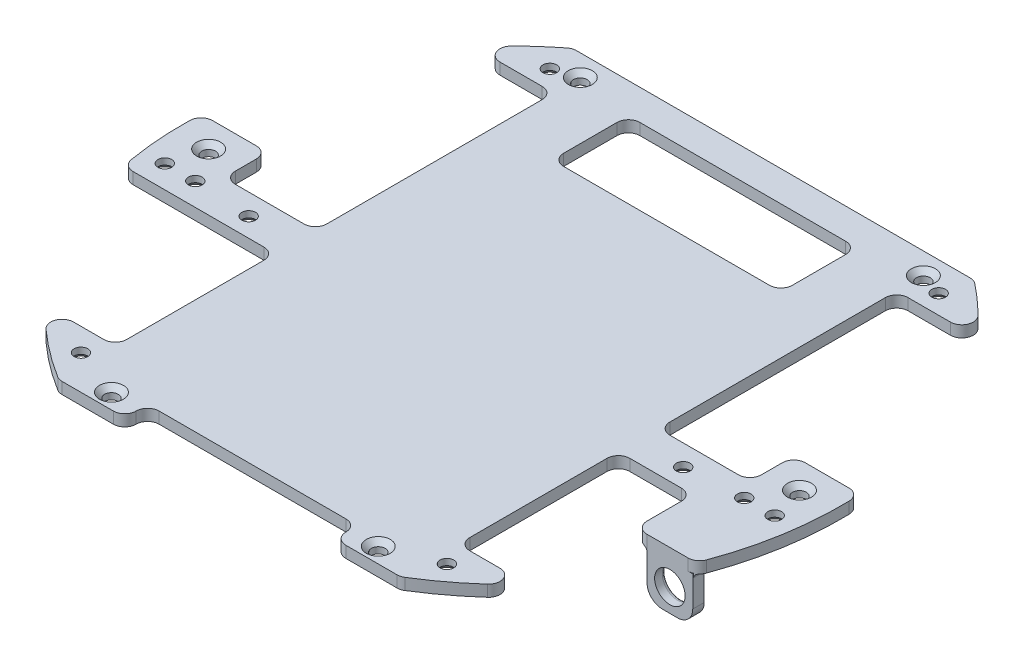
from build123d import *

# Parameters (mm, degrees)
BOSS_EXTRUDE1_DEPTH                           = 3
CSK_FOR_M3_COUNTERSUNK_FLAT_HEAD_SCR_2_COUNT  = 2
CSK_FOR_M3_COUNTERSUNK_FLAT_HEAD_SCR_2_PITCH  = 90
CSK_FOR_M3_COUNTERSUNK_FLAT_HEAD_SCR_3_COUNT  = 2
CSK_FOR_M3_COUNTERSUNK_FLAT_HEAD_SCR_3_PITCH  = 138.676782484
CSK_FOR_M3_COUNTERSUNK_FLAT_HEAD_SCR_4_COUNT  = 2
CSK_FOR_M3_COUNTERSUNK_FLAT_HEAD_SCR_4_PITCH  = 72.672209269
CSK_FOR_M3_COUNTERSUNK_FLAT_HEAD_SCR_5_COUNT  = 2
CSK_FOR_M3_COUNTERSUNK_FLAT_HEAD_SCR_5_PITCH  = 133.375410027
CSK_FOR_M3_COUNTERSUNK_FLAT_HEAD_SCR_6_COUNT  = 2
CSK_FOR_M3_COUNTERSUNK_FLAT_HEAD_SCR_6_PITCH  = 155.206314305
CSK_FOR_M3_COUNTERSUNK_FLAT_HEAD_SCR_7_COUNT  = 2
CSK_FOR_M3_COUNTERSUNK_FLAT_HEAD_SCR_7_PITCH  = 102
CSK_FOR_M3_COUNTERSUNK_FLAT_HEAD_SCR_8_COUNT  = 2
CSK_FOR_M3_COUNTERSUNK_FLAT_HEAD_SCR_8_PITCH  = 126.035709226
CSK_FOR_M3_COUNTERSUNK_FLAT_HEAD_SCR_9_COUNT  = 2
CSK_FOR_M3_COUNTERSUNK_FLAT_HEAD_SCR_9_PITCH  = 160.240444333
CSK_FOR_M3_COUNTERSUNK_FLAT_HEAD_SCR_10_COUNT = 2
CSK_FOR_M3_COUNTERSUNK_FLAT_HEAD_SCR_10_PITCH = 77.620873481
CSK_FOR_M3_COUNTERSUNK_FLAT_HEAD_SCR_11_COUNT = 2
CSK_FOR_M3_COUNTERSUNK_FLAT_HEAD_SCR_11_PITCH = 149.48244044
CSK_FOR_M3_COUNTERSUNK_FLAT_HEAD_SCR_12_COUNT = 2
CSK_FOR_M3_COUNTERSUNK_FLAT_HEAD_SCR_12_PITCH = 73.246160309
CSK_FOR_M3_COUNTERSUNK_FLAT_HEAD_SCR_13_COUNT = 2
CSK_FOR_M3_COUNTERSUNK_FLAT_HEAD_SCR_13_PITCH = 130.357201566
CSK_FOR_M3_COUNTERSUNK_FLAT_HEAD_SCR_14_COUNT = 2
CSK_FOR_M3_COUNTERSUNK_FLAT_HEAD_SCR_14_PITCH = 142.523682243
CSK_FOR_M3_COUNTERSUNK_FLAT_HEAD_SCR_15_COUNT = 2
CSK_FOR_M3_COUNTERSUNK_FLAT_HEAD_SCR_15_PITCH = 75
SKETCH14_W                                    = 60
SKETCH14_H                                    = 20
CUT_EXTRUDE1_DEPTH                            = 123.366253518
FILLET1_R                                     = 3
BOSS_EXTRUDE3_REACH                           = 115.874
SKETCH21_W                                    = 12
SKETCH21_H                                    = 12
SKETCH21_R                                    = 4
SKETCH21_2_W                                  = 12
SKETCH21_2_H                                  = 12
CUT_EXTRUDE3_DEPTH                            = 29
FILLET2_R                                     = 4
FILLET3_R                                     = 1


with BuildPart() as part:
    # Sketch1 → Boss-Extrude1 (new body)
    with BuildSketch(Plane(origin=(0, 0, 0), x_dir=(1, 0, 0), z_dir=(0, 1, 0))):
        with BuildLine():
            Line((-52.657863609, 68.625063935), (52.657863609, 68.625063935))
            ThreePointArc((52.657863609, 68.625063935), (0, -86.5), (-52.657863609, 68.625063935))
        make_face()
    extrude(amount=BOSS_EXTRUDE1_DEPTH)

    # Sketch9 → CSK for M3 Countersunk Flat Head Screw3 (revolve, cut)
    with BuildSketch(Plane(origin=(-45, 3, -63), x_dir=(0, 0, 1), z_dir=(1, 0, 0))):
        Polygon((0, 0), (0, 3), (1.8, 3), (1.8, 1.35), (3.15, 0), align=None)
    csk_for_m3_countersunk_flat_head_screw3 = revolve(axis=Axis((-45, 9.35, -63), (0, -1, 0)), mode=Mode.SUBTRACT)

    # CSK for M3 Countersunk Flat Head Scr 2: CSK for M3 Countersunk Flat Head Screw3 ×2
    with Locations(*[(i * CSK_FOR_M3_COUNTERSUNK_FLAT_HEAD_SCR_2_PITCH, 0, 0) for i in range(1, CSK_FOR_M3_COUNTERSUNK_FLAT_HEAD_SCR_2_COUNT)]):
        add(csk_for_m3_countersunk_flat_head_screw3, mode=Mode.SUBTRACT)

    # CSK for M3 Countersunk Flat Head Scr 3: CSK for M3 Countersunk Flat Head Screw3 ×2
    with Locations(*[Vector(0.8833490206949295, 0, 0.46871580689935033) * (i * CSK_FOR_M3_COUNTERSUNK_FLAT_HEAD_SCR_3_PITCH) for i in range(1, CSK_FOR_M3_COUNTERSUNK_FLAT_HEAD_SCR_3_COUNT)]):
        add(csk_for_m3_countersunk_flat_head_screw3, mode=Mode.SUBTRACT)

    # CSK for M3 Countersunk Flat Head Scr 4: CSK for M3 Countersunk Flat Head Screw3 ×2
    with Locations(*[Vector(-0.4472135954999581, 0, 0.894427190999916) * (i * CSK_FOR_M3_COUNTERSUNK_FLAT_HEAD_SCR_4_PITCH) for i in range(1, CSK_FOR_M3_COUNTERSUNK_FLAT_HEAD_SCR_4_COUNT)]):
        add(csk_for_m3_countersunk_flat_head_screw3, mode=Mode.SUBTRACT)

    # CSK for M3 Countersunk Flat Head Scr 5: CSK for M3 Countersunk Flat Head Screw3 ×2
    with Locations(*[Vector(0.07497633932626105, 0, 0.9971853130392733) * (i * CSK_FOR_M3_COUNTERSUNK_FLAT_HEAD_SCR_5_PITCH) for i in range(1, CSK_FOR_M3_COUNTERSUNK_FLAT_HEAD_SCR_5_COUNT)]):
        add(csk_for_m3_countersunk_flat_head_screw3, mode=Mode.SUBTRACT)

    # CSK for M3 Countersunk Flat Head Scr 6: CSK for M3 Countersunk Flat Head Screw3 ×2
    with Locations(*[Vector(0.5154429467542566, 0, 0.8569238989789517) * (i * CSK_FOR_M3_COUNTERSUNK_FLAT_HEAD_SCR_6_PITCH) for i in range(1, CSK_FOR_M3_COUNTERSUNK_FLAT_HEAD_SCR_6_COUNT)]):
        add(csk_for_m3_countersunk_flat_head_screw3, mode=Mode.SUBTRACT)

    # Sketch13 → CSK for M3 Countersunk Flat Head Screw4 (revolve, cut)
    with BuildSketch(Plane(origin=(-51, 0, -61), x_dir=(0, 0, -1), z_dir=(1, 0, 0))):
        Polygon((0, 0), (0, 3), (1.8, 3), (1.8, 1.35), (3.15, 0), align=None)
    csk_for_m3_countersunk_flat_head_screw4 = revolve(axis=Axis((-51, -6.35, -61), (0, 1, 0)), mode=Mode.SUBTRACT)

    # CSK for M3 Countersunk Flat Head Scr 7: CSK for M3 Countersunk Flat Head Screw4 ×2
    with Locations(*[(i * CSK_FOR_M3_COUNTERSUNK_FLAT_HEAD_SCR_7_PITCH, 0, 0) for i in range(1, CSK_FOR_M3_COUNTERSUNK_FLAT_HEAD_SCR_7_COUNT)]):
        add(csk_for_m3_countersunk_flat_head_screw4, mode=Mode.SUBTRACT)

    # CSK for M3 Countersunk Flat Head Scr 8: CSK for M3 Countersunk Flat Head Screw4 ×2
    with Locations(*[Vector(0.023802777946288843, 0, 0.9997166737441362) * (i * CSK_FOR_M3_COUNTERSUNK_FLAT_HEAD_SCR_8_PITCH) for i in range(1, CSK_FOR_M3_COUNTERSUNK_FLAT_HEAD_SCR_8_COUNT)]):
        add(csk_for_m3_countersunk_flat_head_screw4, mode=Mode.SUBTRACT)

    # CSK for M3 Countersunk Flat Head Scr 9: CSK for M3 Countersunk Flat Head Screw4 ×2
    with Locations(*[Vector(0.6178215519319036, 0, 0.7863183388224227) * (i * CSK_FOR_M3_COUNTERSUNK_FLAT_HEAD_SCR_9_PITCH) for i in range(1, CSK_FOR_M3_COUNTERSUNK_FLAT_HEAD_SCR_9_COUNT)]):
        add(csk_for_m3_countersunk_flat_head_screw4, mode=Mode.SUBTRACT)

    # CSK for M3 Countersunk Flat Head Scr 10: CSK for M3 Countersunk Flat Head Screw4 ×2
    with Locations(*[Vector(-0.373610843312482, 0, 0.9275855420171965) * (i * CSK_FOR_M3_COUNTERSUNK_FLAT_HEAD_SCR_10_PITCH) for i in range(1, CSK_FOR_M3_COUNTERSUNK_FLAT_HEAD_SCR_10_COUNT)]):
        add(csk_for_m3_countersunk_flat_head_screw4, mode=Mode.SUBTRACT)

    # CSK for M3 Countersunk Flat Head Scr 11: CSK for M3 Countersunk Flat Head Screw4 ×2
    with Locations(*[Vector(0.8763571133445796, 0, 0.4816619248916773) * (i * CSK_FOR_M3_COUNTERSUNK_FLAT_HEAD_SCR_11_PITCH) for i in range(1, CSK_FOR_M3_COUNTERSUNK_FLAT_HEAD_SCR_11_COUNT)]):
        add(csk_for_m3_countersunk_flat_head_screw4, mode=Mode.SUBTRACT)

    # CSK for M3 Countersunk Flat Head Scr 12: CSK for M3 Countersunk Flat Head Screw4 ×2
    with Locations(*[Vector(-0.08191555672945391, 0, 0.996639273541688) * (i * CSK_FOR_M3_COUNTERSUNK_FLAT_HEAD_SCR_12_PITCH) for i in range(1, CSK_FOR_M3_COUNTERSUNK_FLAT_HEAD_SCR_12_COUNT)]):
        add(csk_for_m3_countersunk_flat_head_screw4, mode=Mode.SUBTRACT)

    # CSK for M3 Countersunk Flat Head Scr 13: CSK for M3 Countersunk Flat Head Screw4 ×2
    with Locations(*[Vector(0.8284927775601016, 0, 0.559999747795254) * (i * CSK_FOR_M3_COUNTERSUNK_FLAT_HEAD_SCR_13_PITCH) for i in range(1, CSK_FOR_M3_COUNTERSUNK_FLAT_HEAD_SCR_13_COUNT)]):
        add(csk_for_m3_countersunk_flat_head_screw4, mode=Mode.SUBTRACT)

    # CSK for M3 Countersunk Flat Head Scr 14: CSK for M3 Countersunk Flat Head Screw4 ×2
    with Locations(*[Vector(0.8630144693469346, 0, 0.5051792015689374) * (i * CSK_FOR_M3_COUNTERSUNK_FLAT_HEAD_SCR_14_PITCH) for i in range(1, CSK_FOR_M3_COUNTERSUNK_FLAT_HEAD_SCR_14_COUNT)]):
        add(csk_for_m3_countersunk_flat_head_screw4, mode=Mode.SUBTRACT)

    # CSK for M3 Countersunk Flat Head Scr 15: CSK for M3 Countersunk Flat Head Screw4 ×2
    with Locations(*[Vector(-0.2800000000000003, 0, 0.96) * (i * CSK_FOR_M3_COUNTERSUNK_FLAT_HEAD_SCR_15_PITCH) for i in range(1, CSK_FOR_M3_COUNTERSUNK_FLAT_HEAD_SCR_15_COUNT)]):
        add(csk_for_m3_countersunk_flat_head_screw4, mode=Mode.SUBTRACT)

    # Sketch14 → Cut-Extrude1 (cut, through all)
    with BuildSketch(Plane(origin=(0, 3, 0), x_dir=(1, 0, 0), z_dir=(0, 1, 0))):
        with BuildLine():
            Line((65.926094985, 56), (45, 56))
            Line((45, 56), (45, 5))
            Line((45, 5), (45, -6.5))
            Line((45, -6.5), (69, -6.5))
            Line((69, -6.5), (69, 5))
            Line((69, 5), (86.355370418, 5))
            ThreePointArc((86.355370418, 5), (80.297329821, 32.165024851), (65.926094985, 56))
        make_face()
        with BuildLine():
            Line((64.5, -17), (45, -17))
            Line((45, -17), (45, -59))
            Line((45, -59), (63.255434549, -59))
            ThreePointArc((63.255434549, -59), (73.067302991, -46.297075864), (80.363237864, -32))
            Line((80.363237864, -32), (64.5, -32))
            Line((64.5, -32), (64.5, -17))
        make_face()
        with BuildLine():
            Line((-45, -59), (-63.255434549, -59))
            ThreePointArc((-63.255434549, -59), (-73.067302991, -46.297075864), (-80.363237864, -32))
            ThreePointArc((-80.363237864, -32), (-82.927979827, -24.600816282), (-84.813029659, -17))
            Line((-84.813029659, -17), (-64.5, -17))
            Line((-64.5, -17), (-45, -17))
            Line((-45, -17), (-45, -59))
        make_face()
        with BuildLine():
            Line((-69, 5), (-86.355370418, 5))
            ThreePointArc((-86.355370418, 5), (-80.297329821, 32.165024851), (-65.926094985, 56))
            Line((-65.926094985, 56), (-45, 56))
            Line((-45, 56), (-45, 5))
            Line((-45, 5), (-45, -6.5))
            Line((-45, -6.5), (-69, -6.5))
            Line((-69, -6.5), (-69, 5))
        make_face()
        with Locations((0, 50.625063935)):
            Rectangle(SKETCH14_W, SKETCH14_H)
        with BuildLine():
            Line((44.791182168, -74), (27.5, -74))
            Line((27.5, -74), (27.5, -68))
            Line((27.5, -68), (-27.5, -68))
            Line((-27.5, -68), (-27.5, -74))
            Line((-27.5, -74), (-44.791182168, -74))
            ThreePointArc((-44.791182168, -74), (0, -86.5), (44.791182168, -74))
        make_face()
    extrude(amount=-CUT_EXTRUDE1_DEPTH, mode=Mode.SUBTRACT)

    # Fillet1
    fillet1_edges = [part.edges().sort_by_distance(p)[0] for p in [
        (65.926094985, 1.5, -56),
        (45, 1.5, -56),
        (86.355370418, 1.5, -5),
        (45, 1.5, 17),
        (45, 1.5, 59),
        (63.255434549, 1.5, 59),
        (-63.255434549, 1.5, 59),
        (-45, 1.5, 59),
        (-84.813029659, 1.5, 17),
        (-45, 1.5, 17),
        (-86.355370418, 1.5, -5),
        (-65.926094985, 1.5, -56),
        (-45, 1.5, -56),
        (-30, 1.5, -40.625063935),
        (-30, 1.5, -60.625063935),
        (30, 1.5, -40.625063935),
        (30, 1.5, -60.625063935),
        (80.363237864, 1.5, 32),
        (64.5, 1.5, 32),
        (64.5, 1.5, 17),
        (-52.657863609, 1.5, -68.625063935),
        (52.657863609, 1.5, -68.625063935),
        (44.791182168, 1.5, 74),
        (-27.5, 1.5, 74),
        (-27.5, 1.5, 68),
        (27.5, 1.5, 68),
        (27.5, 1.5, 74),
        (-44.791182168, 1.5, 74),
        (-69, 1.5, 6.5),
        (-69, 1.5, -5),
        (-45, 1.5, 6.5),
        (69, 1.5, -5),
        (69, 1.5, 6.5),
        (45, 1.5, 6.5),
    ]]
    fillet(fillet1_edges, radius=FILLET1_R - 0.0001)  # a hair under: the kernel refuses the full size

    # Boss-Extrude3: up to this face of the body (flat: up to its plane)
    boss_extrude3_end = Plane(part.part.faces().sort_by_distance((72.901134209, 1.5, 32))[0])
    # Sketch21 → Boss-Extrude3 (add, up to the picked face)
    with BuildSketch(Plane.XY, mode=Mode.PRIVATE) as boss_extrude3_sk1:
        with Locations((73.5, -6)):
            Rectangle(SKETCH21_W, SKETCH21_H)
        with Locations(Location((73.5, -6, 0), (0, 0, 180))):
            Circle(SKETCH21_R, mode=Mode.SUBTRACT)
    boss_extrude3_tool1 = split(extrude(boss_extrude3_sk1.sketch, amount=BOSS_EXTRUDE3_REACH, mode=Mode.PRIVATE), bisect_by=boss_extrude3_end, keep=Keep.BOTH, mode=Mode.PRIVATE)
    add(boss_extrude3_tool1.solids().sort_by(Axis((73.5, -0.169706, 0), (0, 0, 1)))[0])

    # Sketch21<2> → Cut-Extrude3 (cut)
    with BuildSketch(Plane.XY):
        with Locations((73.5, -6)):
            Rectangle(SKETCH21_2_W, SKETCH21_2_H)
    extrude(amount=CUT_EXTRUDE3_DEPTH, mode=Mode.SUBTRACT)

    # Fillet2
    fillet2_edges = [part.edges().sort_by_distance(p)[0] for p in [
        (79.5, -12, 30.5),
        (67.5, -12, 30.5),
    ]]
    fillet(fillet2_edges, radius=FILLET2_R)

    # Fillet3
    fillet3_edges = [part.edges().sort_by_distance(p)[0] for p in [
        (79.5, 0, 30.375284399),
        (67.5, 0, 30.5),
        (77.5, -6, 29),
    ]]
    fillet(fillet3_edges, radius=FILLET3_R)


solid = part.part
